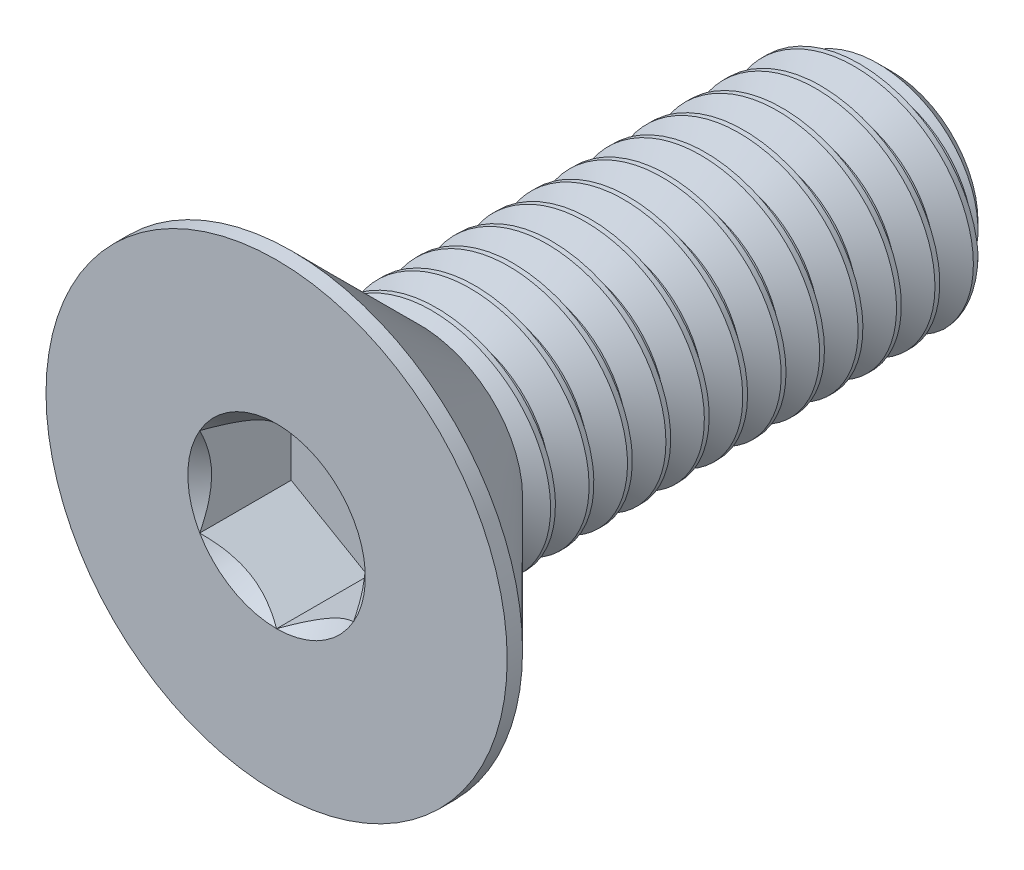
from build123d import *
from build123d.topology import SkipClean

# Parameters (mm, degrees)
SKETCH1_W          = 8
SKETCH1_H          = 1.5
CHAMFER1_SIZE      = 0.375
CUT_SWEEP1_PITCH   = 0.5
CUT_EXTRUDE2_DEPTH = 1.19


with BuildPart() as part:
    # Sketch1 → Revolve1 (revolve)
    with BuildSketch(Plane(origin=(0, 0, 0), x_dir=(0, 0, -1), z_dir=(1, 0, 0))):
        with Locations((4, 0.75)):
            Rectangle(SKETCH1_W, SKETCH1_H)
    revolve(axis=Axis((0, 0, -8), (0, 0, 1)))

    # Chamfer1
    chamfer1_edges = [part.edges().sort_by_distance(p)[0] for p in [
        (0, -1.5, -8),
    ]]
    chamfer(chamfer1_edges, length=CHAMFER1_SIZE)

    # Cut-Sweep1: arcs per turn and ends read off the stored shape
    # Cut-Sweep1: the profile of Sketch2 profile screwed along a right-hand helix through 17 turns, 6 arcs to a turn; built about Z, then put on its axis
    cut_sweep1_z = Axis((0, 0, 0), (0, 0, 1))
    cut_sweep1_corners = [(1.5006, 0, 0.00034641), (1.5006, 0, -0.43784641), (1.175240474, 0, -0.25), (1.175240474, 0, -0.1875)]
    with BuildLine(mode=Mode.PRIVATE) as cut_sweep1_profile:
        Line(cut_sweep1_corners[0], cut_sweep1_corners[1])
        Line(cut_sweep1_corners[1], cut_sweep1_corners[2])
        Line(cut_sweep1_corners[2], cut_sweep1_corners[3])
        Line(cut_sweep1_corners[3], cut_sweep1_corners[0])
    cut_sweep1_cap = Face(cut_sweep1_profile.wire())
    cut_sweep1_turn_angles = [0, 30, 60, 90, 120, 150, 180, 210, 240, 270, 300, 330, 360]
    cut_sweep1_turn_weights = [1, 0.8660254037844387, 1, 0.8660254037844387, 1, 0.8660254037844387, 1, 0.8660254037844387, 1, 0.8660254037844387, 1, 0.8660254037844387, 1]
    cut_sweep1_turn_rails = [Edge.make_bspline([Vector(p[0], p[1], 0).rotate(cut_sweep1_z, cut_sweep1_turn_angles[k]) / cut_sweep1_turn_weights[k] + Vector(0, 0, p[2] + CUT_SWEEP1_PITCH * cut_sweep1_turn_angles[k] / 360) for k in range(13)], [0, 0, 0, 1, 1, 2, 2, 3, 3, 4, 4, 5, 5, 6, 6, 6], 2, cut_sweep1_turn_weights) for p in cut_sweep1_corners]
    cut_sweep1_turn_sides = [Face.make_surface_from_curves(cut_sweep1_turn_rails[p[0]], cut_sweep1_turn_rails[p[1]]) for p in [(0, 1), (1, 2), (2, 3), (3, 0)]]
    cut_sweep1 = Plane(origin=(0, 0, -8), x_dir=(0, 1, 0), z_dir=(0, 0, 1)) * Solid(Shell([*[p.moved(Location((0, 0, CUT_SWEEP1_PITCH * i))) for i in range(17) for p in cut_sweep1_turn_sides], cut_sweep1_cap, cut_sweep1_cap.rotate(cut_sweep1_z, 6120).moved(Location((0, 0, CUT_SWEEP1_PITCH * 6120 / 360)))]))
    add(cut_sweep1, mode=Mode.SUBTRACT)

    # Sketch7 → Revolve2 (revolve)
    with BuildSketch(Plane(origin=(0, 0, 0), x_dir=(0, 0, -1), z_dir=(1, 0, 0)), mode=Mode.PRIVATE) as revolve2_sk:
        Polygon((0, 3), (0.2, 3), (1.7, 1.5), (1.7, 0), (0, 0), align=None)
    revolve(revolve2_sk.sketch.rotate(Axis((0, 0, 0), (0, 0, -1)), 180), axis=Axis((0, 0, 0), (0, 0, -1)))

    # Boss-Extrude1 cone 1 section (through the dimple's axis) → Boss-Extrude1 (revolve)
    with SkipClean():  # the faces are left unmerged after this step: merging them gives an invalid solid
        with BuildSketch(Plane(origin=(0, 0, -1.7), x_dir=(0, -1, 0), z_dir=(1, 0, 0))):
            Polygon((0, 0), (1.5, 0), (0, 1.5), align=None)
        revolve(axis=Axis((0, 0, -1.7), (0, 0, -1)))

    # Sketch5 → Cut-Extrude2 (cut)
    with SkipClean():  # the faces are left unmerged after this step: merging them gives an invalid solid
        with BuildSketch(Plane.XY):
            Polygon((1, -0.577350269), (1, 0.577350269), (0, 1.154700538), (-1, 0.577350269), (-1, -0.577350269), (0, -1.154700538), align=None)
        extrude(amount=-CUT_EXTRUDE2_DEPTH, mode=Mode.SUBTRACT)

    # Cut-Extrude3 cone 1 section (through the dimple's axis) → Cut-Extrude3 (revolve, cut)
    with SkipClean():  # the faces are left unmerged after this step: merging them gives an invalid solid
        with BuildSketch(Plane(origin=(0, 0, 0), x_dir=(0, -1, 0), z_dir=(1, 0, 0))):
            Polygon((0, 0), (1.154700538, 0), (0, 1.154700538), align=None)
        revolve(axis=Axis((0, 0, 0), (0, 0, -1)), mode=Mode.SUBTRACT)


solid = part.part
